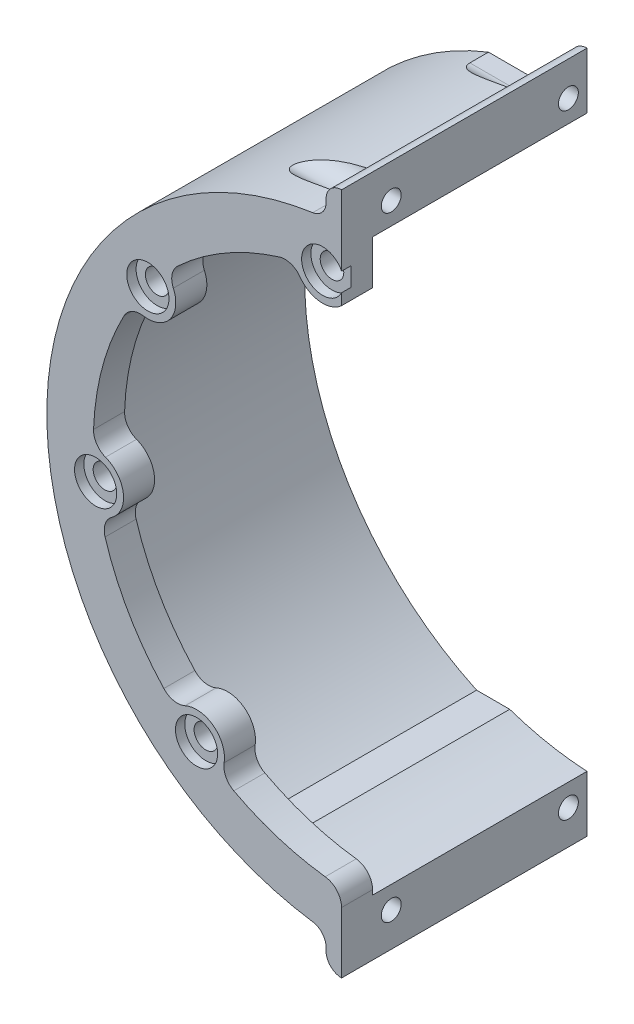
from build123d import *

# Parameters (mm, degrees)
EXTRUDE_1_DEPTH      = 5
EXTRUDE_START        = 34.55
EXTRUDE_2_DEPTH      = 34.55
SKETCH_3_W           = 2.5
SKETCH_3_H           = 100
CUT_EXTRUDE_1_DEPTH  = 41
SKETCH_4_R           = 38
CUT_EXTRUDE_2_DEPTH  = 5
EXTRUDE_3_DEPTH      = 39.55
SKETCH_6_R           = 1.9
CUT_EXTRUDE_3_DEPTH  = 10
SKETCH_7_R           = 1.6
CUT_EXTRUDE_4_DEPTH  = 81.467089546
CUT_EXTRUDE_START    = -2.5
SKETCH_9_R           = 3
CUT_EXTRUDE_7_DEPTH  = 78.967089648
CUT_EXTRUDE_START_2  = -10
CUT_EXTRUDE_8_DEPTH  = 10
FILLET_1_R           = 3
CUT_EXTRUDE_9_DEPTH  = 34.55
MIRROR_START         = -33.1500001
MIRROR_3_DEPTH       = 38.1500001
MIRROR_START_2       = -28.5499999
MIRROR_3_2_DEPTH     = 22.5499998
MIRROR_3_3_DEPTH     = 5
MIRROR_START_3       = -34.55
MIRROR_3_4_DEPTH     = 39.55
MIRROR_3_5_OUTLINE_R = 1.9
MIRROR_3_5_DEPTH     = 5
MIRROR_START_4       = -31.550000102
MIRROR_3_6_DEPTH     = 31.550000102
MIRROR_START_5       = 2.5
MIRROR_3_7_DEPTH     = 48.5
MIRROR_START_6       = -43
MIRROR_3_8_DEPTH     = 43
MIRROR_3_9_OUTLINE_R = 1.6
MIRROR_3_9_DEPTH     = 2.5
SKETCH_13_R          = 3.4
CUT_EXTRUDE_10_DEPTH = 1.5


with BuildPart() as part:
    # 草图1 → 凸台-拉伸1 (new body)
    with BuildSketch(Plane.XY):
        with BuildLine():
            Line((0, 0), (0, 50))
            ThreePointArc((0, 50), (50, 0), (0, -50))
            Line((0, -50), (0, 0))
        make_face()
    extrude(amount=EXTRUDE_1_DEPTH)

    # 草图2 → 凸台-拉伸2 (add)
    with BuildSketch(Plane(origin=(0, 0, 0), x_dir=(-1, 0, 0), z_dir=(0, 0, -1)).offset(EXTRUDE_START)):
        with BuildLine():
            Line((0, 46), (0, 50))
            ThreePointArc((0, 50), (-50, 0), (0, -50))
            Line((0, -50), (0, -46))
            ThreePointArc((0, -46), (-46, 0), (0, 46))
        make_face()
    extrude(amount=-EXTRUDE_2_DEPTH)

    # 草图3 → 切除-拉伸1 (cut)
    with BuildSketch(Plane.XY.offset(5)):
        with Locations((1.25, 0)):
            Rectangle(SKETCH_3_W, SKETCH_3_H)
    extrude(amount=-CUT_EXTRUDE_1_DEPTH, mode=Mode.SUBTRACT)

    # 草图4 → 切除-拉伸2 (cut)
    with BuildSketch(Plane.XY.offset(5)):
        Circle(SKETCH_4_R)
    extrude(amount=-CUT_EXTRUDE_2_DEPTH, mode=Mode.SUBTRACT)

    # 草图5 → 凸台-拉伸3 (add)
    with BuildSketch(Plane.XY.offset(5)):
        with BuildLine():
            Line((5, -52.5), (5, -51.961524227))
            ThreePointArc((5, -51.961524227), (5.610177635, -50.32489005), (7.142857143, -49.487165931))
            Line((7.142857143, -49.487165931), (2.5, -49.937460889))
            Line((2.5, -49.937460889), (2.5, -55))
            ThreePointArc((2.5, -55), (4.267766953, -54.267766953), (5, -52.5))
        make_face()
        with BuildLine():
            Line((2.5, 55), (2.5, 49.937460889))
            Line((2.5, 49.937460889), (7.142857143, 49.487165931))
            ThreePointArc((7.142857143, 49.487165931), (5.610177635, 50.32489005), (5, 51.961524227))
            Line((5, 51.961524227), (5, 52.5))
            ThreePointArc((5, 52.5), (4.267766953, 54.267766953), (2.5, 55))
        make_face()
    extrude(amount=-EXTRUDE_3_DEPTH)

    # 草图6 → 切除-拉伸3 (cut)
    with BuildSketch(Plane.XY.offset(5)):
        with Locations((33.717516962, 25.872360733)):
            Circle(SKETCH_6_R)
        with Locations((5.547363169, 42.136406608)):
            Circle(SKETCH_6_R)
        with Locations((42.136406608, -5.547363169)):
            Circle(SKETCH_6_R)
        with Locations((25.872360733, -33.717516962)):
            Circle(SKETCH_6_R)
        with Locations((-5.547363169, -42.136406608)):
            Circle(SKETCH_6_R)
        with Locations((-33.717516962, -25.872360733)):
            Circle(SKETCH_6_R)
        with Locations((-42.136406608, 5.547363169)):
            Circle(SKETCH_6_R)
        with Locations((-25.872360733, 33.717516962)):
            Circle(SKETCH_6_R)
    extrude(amount=-CUT_EXTRUDE_3_DEPTH, mode=Mode.SUBTRACT)

    # 草图7 → 切除-拉伸4 (cut, through all)
    with BuildSketch(Plane.ZY.offset(-2.5)):
        with Locations((-3, 49.5)):
            Circle(SKETCH_7_R)
        with Locations((-31.55, 49.5)):
            Circle(SKETCH_7_R)
        with Locations(Location((-31.55, -49.5, 0), (0, 0, 0.459591187))):
            Circle(SKETCH_7_R)
        with Locations(Location((-3, -49.5, 0), (0, 0, 0.459591187))):
            Circle(SKETCH_7_R)
    extrude(amount=-CUT_EXTRUDE_4_DEPTH, mode=Mode.SUBTRACT)

    # 草图9 → 切除-拉伸7 (cut, through all)
    with BuildSketch(Plane.ZY.offset(-2.5).offset(CUT_EXTRUDE_START)):
        with Locations((-3, 49.5)):
            Circle(SKETCH_9_R)
        with Locations((-3, -49.5)):
            Circle(SKETCH_9_R)
        with BuildLine():
            Line((-31.55, 52.5), (-34.55, 52.5))
            Line((-34.55, 52.5), (-34.55, 46.5))
            Line((-34.55, 46.5), (-31.55, 46.5))
            ThreePointArc((-31.55, 46.5), (-28.55, 49.5), (-31.55, 52.5))
        make_face()
        with BuildLine():
            Line((-31.55, -46.5), (-34.55, -46.5))
            Line((-34.55, -46.5), (-34.55, -52.5))
            Line((-34.55, -52.5), (-31.55, -52.5))
            ThreePointArc((-31.55, -52.5), (-28.55, -49.5), (-31.55, -46.5))
        make_face()
    extrude(amount=-CUT_EXTRUDE_7_DEPTH, mode=Mode.SUBTRACT)

    # 草图11 → 切除-拉伸8 (cut)
    with BuildSketch(Plane(origin=(0, 0, 0), x_dir=(-1, 0, 0), z_dir=(0, 0, -1)).offset(CUT_EXTRUDE_START_2)):
        with BuildLine():
            ThreePointArc((-30.147426931, 23.132934302), (-19, 32.908965344), (-4.959995304, 37.674904732))
            ThreePointArc((-4.959995304, 37.674904732), (-8.191293479, 38.495028776), (-9.971512435, 41.313665291))
            ThreePointArc((-9.971512435, 41.313665291), (-21.25, 36.806079661), (-30.792927448, 29.292415728))
            ThreePointArc((-30.792927448, 29.292415728), (-29.2420261, 26.34138263), (-30.147426931, 23.132934302))
        make_face()
        with BuildLine():
            ThreePointArc((-37.674904732, -4.959995304), (-36.705181399, 9.835123714), (-30.147426931, 23.132934302))
            ThreePointArc((-30.147426931, 23.132934302), (-33.012215055, 21.427976724), (-36.264096944, 22.162248821))
            ThreePointArc((-36.264096944, 22.162248821), (-41.051847617, 10.999809417), (-42.48675361, -1.061022012))
            ThreePointArc((-42.48675361, -1.061022012), (-39.303405234, -2.051064667), (-37.674904732, -4.959995304))
        make_face()
        with BuildLine():
            ThreePointArc((-23.132934302, -30.147426931), (-32.908965344, -19), (-37.674904732, -4.959995304))
            ThreePointArc((-37.674904732, -4.959995304), (-38.495028776, -8.191293479), (-41.313665291, -9.971512435))
            ThreePointArc((-41.313665291, -9.971512435), (-36.806079661, -21.25), (-29.292415728, -30.792927448))
            ThreePointArc((-29.292415728, -30.792927448), (-26.34138263, -29.2420261), (-23.132934302, -30.147426931))
        make_face()
        with BuildLine():
            ThreePointArc((-2.5, -37.917673979), (-13.392386458, -35.561833262), (-23.132934302, -30.147426931))
            ThreePointArc((-23.132934302, -30.147426931), (-21.427976724, -33.012215055), (-22.162248821, -36.264096944))
            ThreePointArc((-22.162248821, -36.264096944), (-12.710237808, -40.554899271), (-2.5, -42.426406871))
            Line((-2.5, -42.426406871), (-2.5, -37.917673979))
        make_face()
        with BuildLine():
            ThreePointArc((23.132934302, 30.147426931), (9.835123714, 36.705181399), (-4.959995304, 37.674904732))
            ThreePointArc((-4.959995304, 37.674904732), (-2.051064667, 39.303405234), (-1.061022012, 42.48675361))
            ThreePointArc((-1.061022012, 42.48675361), (10.999809417, 41.051847617), (22.162248821, 36.264096944))
            ThreePointArc((22.162248821, 36.264096944), (21.427976724, 33.012215055), (23.132934302, 30.147426931))
        make_face()
    extrude(amount=CUT_EXTRUDE_8_DEPTH, mode=Mode.SUBTRACT)

    # 圆角1
    fillet_1_edges = [part.edges().sort_by_distance(p)[0] for p in [
        (9.971512435, 41.313665291, 2.5),
        (30.792927448, 29.292415728, 2.5),
        (41.313665291, -9.971512435, 2.5),
        (29.292415728, -30.792927448, 2.5),
        (36.264096944, 22.162248821, 2.5),
        (42.48675361, -1.061022012, 2.5),
        (22.162248821, -36.264096944, 2.5),
        (2.5, -42.426406871, 2.5),
    ]]
    fillet(fillet_1_edges, radius=FILLET_1_R)

    # 草图12 → 切除-拉伸9 (cut)
    with BuildSketch(Plane(origin=(0, 0, -34.55), x_dir=(-1, 0, 0), z_dir=(0, 0, -1))):
        with BuildLine():
            Line((-2.5, 43.5), (0, 0))
            Line((0, 0), (-2.5, -43.5))
            Line((-2.5, -43.5), (-20.291623888, -43.5))
            ThreePointArc((-20.291623888, -43.5), (-48, 0), (-20.291623888, 43.5))
            Line((-20.291623888, 43.5), (-2.5, 43.5))
        make_face()
    extrude(amount=-CUT_EXTRUDE_9_DEPTH, mode=Mode.SUBTRACT)

    # 镜向3: read off the stored shape, not the designer's step
    # 镜向3 outline → 镜向3 (cut)
    with BuildSketch(Plane.XY.offset(MIRROR_START)):
        with BuildLine():
            Line((5, -46.5), (5, -51.961524227))
            ThreePointArc((5, -51.961524227), (5.610177635, -50.32489005), (7.142857143, -49.487165931))
            ThreePointArc((7.142857143, -49.487165931), (12.847529743, -48.321227008), (18.377975949, -46.5))
            Line((18.377975949, -46.5), (5, -46.5))
        make_face()
        with BuildLine():
            ThreePointArc((7.142857143, 49.487165931), (5.610177635, 50.32489005), (5, 51.961524227))
            Line((5, 51.961524227), (5, 46.5))
            Line((5, 46.5), (18.377975949, 46.5))
            ThreePointArc((18.377975949, 46.5), (12.847529743, 48.321227008), (7.142857143, 49.487165931))
        make_face()
    extrude(amount=MIRROR_3_DEPTH, mode=Mode.SUBTRACT)



with BuildPart() as body_2:
    # Mirror 3 2 outline → Mirror 3 2 (new body)
    with BuildSketch(Plane.XY.offset(MIRROR_START_2)):
        with BuildLine():
            ThreePointArc((-13.377975949, -46.5), (-7.847529743, -48.321227008), (-2.142857143, -49.487165931))
            ThreePointArc((-2.142857143, -49.487165931), (-0.610177635, -50.32489005), (0, -51.961524227))
            Line((0, -51.961524227), (0, -46.5))
            Line((0, -46.5), (-13.377975949, -46.5))
        make_face()
        with BuildLine():
            ThreePointArc((-2.142857143, 49.487165931), (-7.847529743, 48.321227008), (-13.377975949, 46.5))
            Line((-13.377975949, 46.5), (0, 46.5))
            Line((0, 46.5), (0, 51.961524227))
            ThreePointArc((0, 51.961524227), (-0.610177635, 50.32489005), (-2.142857143, 49.487165931))
        make_face()
    extrude(amount=MIRROR_3_2_DEPTH)


with BuildPart() as body_3:
    # Mirror 3 3 outline → Mirror 3 3 (new body)
    with BuildSketch(Plane.XY):
        with BuildLine():
            ThreePointArc((-13.377975949, -46.5), (-7.847529743, -48.321227008), (-2.142857143, -49.487165931))
            ThreePointArc((-2.142857143, -49.487165931), (-0.610177635, -50.32489005), (0, -51.961524227))
            Line((0, -51.961524227), (0, -46.5))
            Line((0, -46.5), (-13.377975949, -46.5))
        make_face()
        with BuildLine():
            ThreePointArc((-2.142857143, 49.487165931), (-7.847529743, 48.321227008), (-13.377975949, 46.5))
            Line((-13.377975949, 46.5), (0, 46.5))
            Line((0, 46.5), (0, 51.961524227))
            ThreePointArc((0, 51.961524227), (-0.610177635, 50.32489005), (-2.142857143, 49.487165931))
        make_face()
    extrude(amount=MIRROR_3_3_DEPTH)


with BuildPart() as part_1:
    add(part.part)

    add(body_2.part)  # Mirror 3 4 merges body 2

    add(body_3.part)  # Mirror 3 4 merges body 3
    # Mirror 3 4 outline → Mirror 3 4 (add)
    with BuildSketch(Plane.XY.offset(MIRROR_START_3)):
        with BuildLine():
            ThreePointArc((-13.377975949, 46.5), (-45, 0), (-13.377975949, -46.5))
            Line((-13.377975949, -46.5), (0, -46.5))
            Line((0, -46.5), (0, -52.5))
            ThreePointArc((0, -52.5), (0.732233047, -54.267766953), (2.5, -55))
            ThreePointArc((2.5, -55), (4.267766953, -54.267766953), (5, -52.5))
            Line((5, -52.5), (5, -46.5))
            Line((5, -46.5), (18.377975949, -46.5))
            ThreePointArc((18.377975949, -46.5), (50, 0), (18.377975949, 46.5))
            Line((18.377975949, 46.5), (5, 46.5))
            Line((5, 46.5), (5, 52.5))
            ThreePointArc((5, 52.5), (4.267766953, 54.267766953), (2.5, 55))
            ThreePointArc((2.5, 55), (0.732233047, 54.267766953), (0, 52.5))
            Line((0, 52.5), (0, 46.5))
            Line((0, 46.5), (-13.377975949, 46.5))
        make_face()
        with BuildLine():
            ThreePointArc((-9.958275302, 43.5), (-3.813428297, 45.147795978), (2.5, 45.932014979))
            ThreePointArc((2.5, 45.932014979), (8.813428297, 45.147795978), (14.958275302, 43.5))
            Line((14.958275302, 43.5), (20.291623888, 43.5))
            ThreePointArc((20.291623888, 43.5), (48, 0), (20.291623888, -43.5))
            Line((20.291623888, -43.5), (14.958275302, -43.5))
            ThreePointArc((14.958275302, -43.5), (8.813428297, -45.147795978), (2.5, -45.932014979))
            ThreePointArc((2.5, -45.932014979), (-3.813428297, -45.147795978), (-9.958275302, -43.5))
            Line((-9.958275302, -43.5), (-15.291623888, -43.5))
            ThreePointArc((-15.291623888, -43.5), (-43, 0), (-15.291623888, 43.5))
            Line((-15.291623888, 43.5), (-9.958275302, 43.5))
        make_face(mode=Mode.SUBTRACT)
    extrude(amount=MIRROR_3_4_DEPTH)

    # Mirror 3 5 outline → Mirror 3 5 (add)
    with BuildSketch(Plane.XY):
        with BuildLine():
            ThreePointArc((14.958275302, 43.5), (8.813428297, 45.147795978), (2.5, 45.932014979))
            ThreePointArc((2.5, 45.932014979), (-3.813428297, 45.147795978), (-9.958275302, 43.5))
            Line((-9.958275302, 43.5), (-15.291623888, 43.5))
            ThreePointArc((-15.291623888, 43.5), (-43, 0), (-15.291623888, -43.5))
            Line((-15.291623888, -43.5), (-9.958275302, -43.5))
            ThreePointArc((-9.958275302, -43.5), (-3.813428297, -45.147795978), (2.5, -45.932014979))
            ThreePointArc((2.5, -45.932014979), (8.813428297, -45.147795978), (14.958275302, -43.5))
            Line((14.958275302, -43.5), (20.291623888, -43.5))
            ThreePointArc((20.291623888, -43.5), (48, 0), (20.291623888, 43.5))
            Line((20.291623888, 43.5), (14.958275302, 43.5))
        make_face()
        with Locations((-20.872360733, -33.717516962)):
            Circle(MIRROR_3_5_OUTLINE_R, mode=Mode.SUBTRACT)
        with Locations((-37.136406608, -5.547363169)):
            Circle(MIRROR_3_5_OUTLINE_R, mode=Mode.SUBTRACT)
        with Locations((25.872360733, -33.717516962)):
            Circle(MIRROR_3_5_OUTLINE_R, mode=Mode.SUBTRACT)
        with BuildLine():
            ThreePointArc((-34.503975044, -9.197062343), (-32.674904732, -4.959995305), (-35.538284629, -1.340701056))
            ThreePointArc((-35.538284629, -1.340701056), (-36.973451793, -0.193694586), (-37.470809468, 1.574910507))
            ThreePointArc((-37.470809468, 1.574910507), (-36.051847617, 10.999809417), (-32.568255172, 19.871492226))
            ThreePointArc((-32.568255172, 19.871492226), (-31.253228245, 21.154470328), (-29.436833787, 21.430223488))
            ThreePointArc((-29.436833787, 21.430223488), (-25.147426931, 23.132934302), (-24.612914767, 27.716877151))
            ThreePointArc((-24.612914767, 27.716877151), (-24.816675148, 29.542749638), (-23.917767478, 31.145027277))
            ThreePointArc((-23.917767478, 31.145027277), (-16.25, 36.806079661), (-7.513501084, 40.616034895))
            ThreePointArc((-7.513501084, 40.616034895), (-5.67643411, 40.593372953), (-4.197062343, 39.503975044))
            ThreePointArc((-4.197062343, 39.503975044), (-1.001080971, 37.659338354), (2.5, 38.825277237))
            ThreePointArc((2.5, 38.825277237), (6.001080971, 37.659338354), (9.197062343, 39.503975044))
            ThreePointArc((9.197062343, 39.503975044), (10.67643411, 40.593372953), (12.513501084, 40.616034895))
            ThreePointArc((12.513501084, 40.616034895), (21.25, 36.806079661), (28.917767478, 31.145027277))
            ThreePointArc((28.917767478, 31.145027277), (29.816675148, 29.542749638), (29.612914767, 27.716877151))
            ThreePointArc((29.612914767, 27.716877151), (30.147426931, 23.132934302), (34.436833787, 21.430223488))
            ThreePointArc((34.436833787, 21.430223488), (36.253228245, 21.154470328), (37.568255172, 19.871492226))
            ThreePointArc((37.568255172, 19.871492226), (41.051847617, 10.999809417), (42.470809468, 1.574910507))
            ThreePointArc((42.470809468, 1.574910507), (41.973451793, -0.193694586), (40.538284629, -1.340701056))
            ThreePointArc((40.538284629, -1.340701056), (37.674904732, -4.959995305), (39.503975044, -9.197062343))
            ThreePointArc((39.503975044, -9.197062343), (40.593372953, -10.67643411), (40.616034895, -12.513501084))
            ThreePointArc((40.616034895, -12.513501084), (36.806079661, -21.25), (31.145027277, -28.917767478))
            ThreePointArc((31.145027277, -28.917767478), (29.542749638, -29.816675148), (27.716877151, -29.612914767))
            ThreePointArc((27.716877151, -29.612914767), (23.132934302, -30.147426931), (21.430223488, -34.436833787))
            ThreePointArc((21.430223488, -34.436833787), (21.154470328, -36.253228245), (19.871492226, -37.568255172))
            ThreePointArc((19.871492226, -37.568255172), (12.716015165, -40.553088148), (5.137362637, -42.18835746))
            ThreePointArc((5.137362637, -42.18835746), (3.254124659, -43.177378531), (2.5, -45.166359163))
            ThreePointArc((2.5, -45.166359163), (1.745875341, -43.177378531), (-0.137362637, -42.18835746))
            ThreePointArc((-0.137362637, -42.18835746), (-7.716015165, -40.553088148), (-14.871492226, -37.568255172))
            ThreePointArc((-14.871492226, -37.568255172), (-16.154470328, -36.253228245), (-16.430223488, -34.436833787))
            ThreePointArc((-16.430223488, -34.436833787), (-18.132934302, -30.147426931), (-22.716877151, -29.612914767))
            ThreePointArc((-22.716877151, -29.612914767), (-24.542749638, -29.816675148), (-26.145027277, -28.917767478))
            ThreePointArc((-26.145027277, -28.917767478), (-31.806079661, -21.25), (-35.616034895, -12.513501084))
            ThreePointArc((-35.616034895, -12.513501084), (-35.593372953, -10.67643411), (-34.503975044, -9.197062343))
        make_face(mode=Mode.SUBTRACT)
        with Locations((42.136406608, -5.547363169)):
            Circle(MIRROR_3_5_OUTLINE_R, mode=Mode.SUBTRACT)
        with Locations((-28.717516962, 25.872360733)):
            Circle(MIRROR_3_5_OUTLINE_R, mode=Mode.SUBTRACT)
        with Locations((-0.547363169, 42.136406608)):
            Circle(MIRROR_3_5_OUTLINE_R, mode=Mode.SUBTRACT)
        with Locations((33.717516962, 25.872360733)):
            Circle(MIRROR_3_5_OUTLINE_R, mode=Mode.SUBTRACT)
        with Locations((5.547363169, 42.136406608)):
            Circle(MIRROR_3_5_OUTLINE_R, mode=Mode.SUBTRACT)
    extrude(amount=MIRROR_3_5_DEPTH)

    # Mirror 3 6 outline → Mirror 3 6 (add)
    with BuildSketch(Plane.XY.offset(MIRROR_START_4)):
        with BuildLine():
            ThreePointArc((-13.377975949, -46.5), (-7.847529743, -48.321227008), (-2.142857143, -49.487165931))
            ThreePointArc((-2.142857143, -49.487165931), (-0.610177635, -50.32489005), (0, -51.961524227))
            Line((0, -51.961524227), (0, -46.5))
            Line((0, -46.5), (-13.377975949, -46.5))
        make_face()
        with BuildLine():
            ThreePointArc((-2.142857143, 49.487165931), (-7.847529743, 48.321227008), (-13.377975949, 46.5))
            Line((-13.377975949, 46.5), (0, 46.5))
            Line((0, 46.5), (0, 51.961524227))
            ThreePointArc((0, 51.961524227), (-0.610177635, 50.32489005), (-2.142857143, 49.487165931))
        make_face()
    extrude(amount=MIRROR_3_6_DEPTH)

    # Mirror 3 7 outline → Mirror 3 7 (cut)
    with BuildSketch(Plane.YZ.offset(MIRROR_START_5)):
        Polygon((56, -34.55), (56, 0), (55.246323457, 0), (56, 1.08180528), (56, 5), (-56, 5), (-56, 1.08180528), (-55.246323457, 0), (-56, 0), (-56, -34.55), align=None)
    extrude(amount=MIRROR_3_7_DEPTH, mode=Mode.SUBTRACT)

    # Mirror 3 8 outline → Mirror 3 8 (cut)
    with BuildSketch(Plane.YZ.offset(MIRROR_START_6)):
        with BuildLine():
            ThreePointArc((-46.5, -31.55), (-48.601271087, -28.687782968), (-51.961524227, -29.835095198))
            Line((-51.961524227, -29.835095198), (-53.156271215, -31.550000102))
            Line((-53.156271215, -31.550000102), (-46.5, -31.55))
        make_face()
        with BuildLine():
            ThreePointArc((-51.961524227, -4.714904802), (-46.5, -3), (-51.961524227, -1.285095198))
            Line((-51.961524227, -1.285095198), (-53.156271143, -3))
            Line((-53.156271143, -3), (-51.961524227, -4.714904802))
        make_face()
        with BuildLine():
            ThreePointArc((51.961524227, -29.835095198), (48.601271086, -28.687782968), (46.5, -31.550000002))
            Line((46.5, -31.550000002), (53.156271215, -31.550000102))
            Line((53.156271215, -31.550000102), (51.961524227, -29.835095198))
        make_face()
        with BuildLine():
            Line((51.961524227, -4.714904802), (53.156271143, -3))
            Line((53.156271143, -3), (51.961524227, -1.285095198))
            ThreePointArc((51.961524227, -1.285095198), (46.5, -3), (51.961524227, -4.714904802))
        make_face()
    extrude(amount=MIRROR_3_8_DEPTH, mode=Mode.SUBTRACT)

    # Mirror 3 9 outline → Mirror 3 9 (cut)
    with BuildSketch(Plane.YZ):
        with Locations((-49.5, -31.55)):
            Circle(MIRROR_3_9_OUTLINE_R)
        with Locations((49.5, -31.55)):
            Circle(MIRROR_3_9_OUTLINE_R)
        with Locations((-49.5, -3)):
            Circle(MIRROR_3_9_OUTLINE_R)
        with Locations((49.5, -3)):
            Circle(MIRROR_3_9_OUTLINE_R)
    extrude(amount=MIRROR_3_9_DEPTH, mode=Mode.SUBTRACT)

    # 草图13 → 切除-拉伸10 (cut)
    with BuildSketch(Plane.XY.offset(5)):
        with Locations((-0.547363169, 42.136406608)):
            Circle(SKETCH_13_R)
        with Locations((-28.717516962, 25.872360733)):
            Circle(SKETCH_13_R)
        with Locations((-37.136406608, -5.547363169)):
            Circle(SKETCH_13_R)
        with Locations((-20.872360733, -33.717516962)):
            Circle(SKETCH_13_R)
    extrude(amount=-CUT_EXTRUDE_10_DEPTH, mode=Mode.SUBTRACT)


solid = part_1.part
